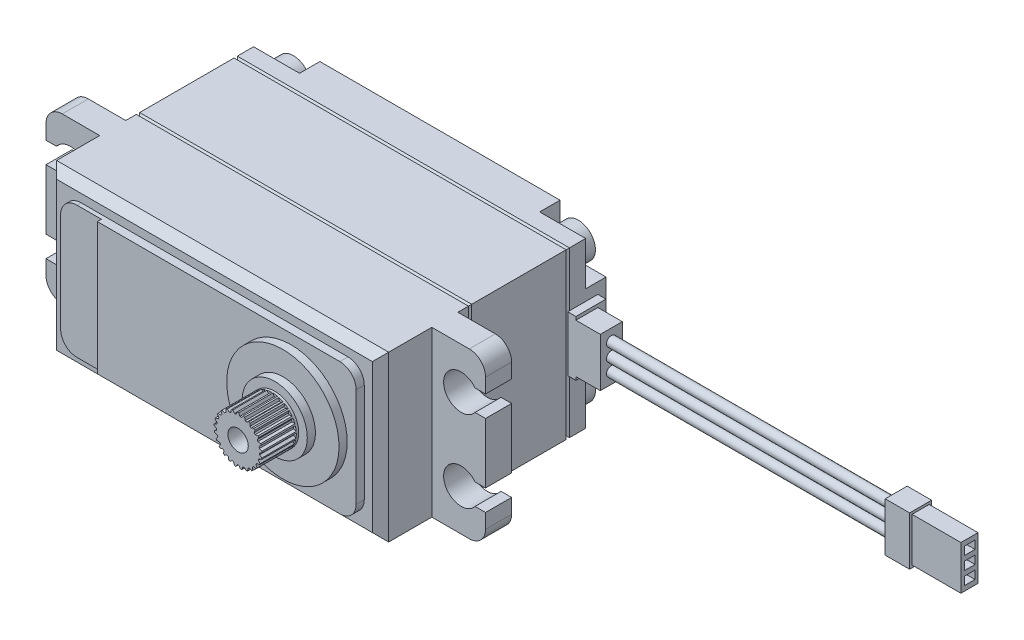
from build123d import *

# Parameters (mm, degrees)
SKETCH_1_W          = 40.8
SKETCH_1_H          = 20.2
EXTRUDE_1_DEPTH     = 4.7
CHAMFER_1_SIZE      = 0.2
SKETCH_2_W          = 40.8
SKETCH_2_H          = 20.2
EXTRUDE_2_DEPTH     = 12
CHAMFER_5_SIZE      = 0.2
SKETCH_3_W          = 40.8
SKETCH_3_H          = 20.2
EXTRUDE_3_DEPTH     = 11
CHAMFER_6_SIZE      = 0.2
CHAMFER_3_SIZE      = 1
CHAMFER_4_SIZE      = 0.2
SKETCH_4_R          = 6.9
EXTRUDE_4_DEPTH     = 2
SKETCH_5_R          = 4
EXTRUDE_5_DEPTH     = 1
SKETCH_6_R          = 2.95
EXTRUDE_6_DEPTH     = 4.5
SKETCH_7_R          = 1.25
CUT_EXTRUDE_1_DEPTH = 5
CUT_EXTRUDE_2_DEPTH = 4.2
EXTRUDE_7_DEPTH     = 3.2
FILLET_1_R          = 2
SKETCH_10_W         = 36.8
SKETCH_10_H         = 16.2
SKETCH_10_R         = 6.9
EXTRUDE_8_DEPTH     = 1
SKETCH_11_W         = 5
SKETCH_11_H         = 16.2
CUT_EXTRUDE_3_DEPTH = 0.5
FILLET_2_R          = 2
SKETCH_12_W         = 3.7
SKETCH_12_H         = 6.8
EXTRUDE_9_DEPTH     = 1
SKETCH_13_W         = 2.7
SKETCH_13_H         = 6
EXTRUDE_10_DEPTH    = 3
SKETCH_14_R         = 0.6
EXTRUDE_11_DEPTH    = 35
SKETCH_15_W         = 2.7
SKETCH_15_H         = 6
EXTRUDE_12_DEPTH    = 3
SKETCH_16_W         = 2.1
SKETCH_16_H         = 5.4
SKETCH_16_W_2       = 1.300246416
SKETCH_16_H_2       = 1
EXTRUDE_13_DEPTH    = 6
SKETCH_17_R         = 1
CUT_EXTRUDE_4_DEPTH = 2.5
SKETCH_18_R         = 1
CUT_EXTRUDE_5_DEPTH = 2.5
SKETCH_19_R         = 2.1
EXTRUDE_14_DEPTH    = 2


with BuildPart() as part:
    # 草图1 → 凸台-拉伸1 (new body)
    with BuildSketch(Plane.XY):
        Rectangle(SKETCH_1_W, SKETCH_1_H)
    extrude(amount=EXTRUDE_1_DEPTH)

    # 倒角1
    chamfer_1_edges = [part.edges().sort_by_distance(p)[0] for p in [
        (0, -10.1, 4.7),
        (20.4, 0, 4.7),
        (-20.4, 0, 4.7),
        (0, 10.1, 4.7),
    ]]
    chamfer(chamfer_1_edges, length=CHAMFER_1_SIZE)



with BuildPart() as body_2:
    # 草图2 → 凸台-拉伸2 (new body)
    with BuildSketch(Plane.XY.offset(4.7)):
        Rectangle(SKETCH_2_W, SKETCH_2_H)
    extrude(amount=EXTRUDE_2_DEPTH)

    # 倒角5
    chamfer_5_edges = [body_2.edges().sort_by_distance(p)[0] for p in [
        (0, -10.1, 16.7),
        (20.4, 0, 16.7),
        (-20.4, 0, 16.7),
        (0, 10.1, 16.7),
    ]]
    chamfer(chamfer_5_edges, length=CHAMFER_5_SIZE)

    # 倒角4
    chamfer_4_edges = [body_2.edges().sort_by_distance(p)[0] for p in [
        (0, 10.1, 4.7),
        (20.4, 0, 4.7),
        (0, -10.1, 4.7),
        (-20.4, 0, 4.7),
    ]]
    chamfer(chamfer_4_edges, length=CHAMFER_4_SIZE)


with BuildPart() as body_3:
    # 草图3 → 凸台-拉伸3 (new body)
    with BuildSketch(Plane.XY.offset(16.7)):
        Rectangle(SKETCH_3_W, SKETCH_3_H)
    extrude(amount=EXTRUDE_3_DEPTH)

    # 倒角6
    chamfer_6_edges = [body_3.edges().sort_by_distance(p)[0] for p in [
        (0, 10.1, 16.7),
        (20.4, 0, 16.7),
        (-20.4, 0, 16.7),
        (0, -10.1, 16.7),
    ]]
    chamfer(chamfer_6_edges, length=CHAMFER_6_SIZE)

    # 倒角3
    chamfer_3_edges = [body_3.edges().sort_by_distance(p)[0] for p in [
        (20.4, 0, 27.7),
        (0, -10.1, 27.7),
        (-20.4, 0, 27.7),
        (0, 10.1, 27.7),
    ]]
    chamfer(chamfer_3_edges, length=CHAMFER_3_SIZE)

    # 草图4 → 凸台-拉伸4 (add)
    with BuildSketch(Plane.XY.offset(27.7)):
        with Locations((10.4, 0)):
            Circle(SKETCH_4_R)
    extrude(amount=EXTRUDE_4_DEPTH)

    # 草图5 → 凸台-拉伸5 (add)
    with BuildSketch(Plane.XY.offset(29.7)):
        with Locations((10.4, 0)):
            Circle(SKETCH_5_R)
    extrude(amount=EXTRUDE_5_DEPTH)

    # 草图6 → 凸台-拉伸6 (add)
    with BuildSketch(Plane.XY.offset(30.7)):
        with Locations((10.4, 0)):
            Circle(SKETCH_6_R)
    extrude(amount=EXTRUDE_6_DEPTH)

    # 草图7 → 切除-拉伸1 (cut)
    with BuildSketch(Plane.XY.offset(35.2)):
        with Locations((10.4, 0)):
            Circle(SKETCH_7_R)
    extrude(amount=-CUT_EXTRUDE_1_DEPTH, mode=Mode.SUBTRACT)

    # 草图8 → 切除-拉伸2 (cut)
    with BuildSketch(Plane.XY.offset(35.2)):
        with BuildLine():
            Line((11.036355222, 2.880547176), (10.812882687, 2.613339954))
            ThreePointArc((10.812882687, 2.613339954), (10.718629565, 2.62690868), (10.623963172, 2.637206039))
            Line((10.623963172, 2.637206039), (10.475180758, 2.949041853))
            ThreePointArc((10.475180758, 2.949041853), (10.757412567, 2.928268474), (11.036355222, 2.880547176))
        make_face()
        with BuildLine():
            Line((10.3, 2.948304598), (10.15, 2.633916823))
            ThreePointArc((10.15, 2.633916823), (10.055333608, 2.623619464), (9.961080485, 2.610050738))
            Line((9.961080485, 2.610050738), (9.739421931, 2.875088975))
            ThreePointArc((9.739421931, 2.875088975), (10.017953037, 2.925156426), (10.3, 2.948304598))
        make_face()
        with BuildLine():
            Line((11.732725904, 2.631794381), (11.449822437, 2.428557325))
            ThreePointArc((11.449822437, 2.428557325), (11.361904854, 2.465139563), (11.27277343, 2.498655986))
            Line((11.27277343, 2.498655986), (11.206215702, 2.837695587))
            ThreePointArc((11.206215702, 2.837695587), (11.47441455, 2.747386645), (11.732725904, 2.631794381))
        make_face()
        with BuildLine():
            Line((12.345356517, 2.217676266), (12.020797982, 2.091179508))
            ThreePointArc((12.020797982, 2.091179508), (11.944740124, 2.148476661), (11.866744123, 2.203106188))
            Line((11.866744123, 2.203106188), (11.886593149, 2.54804647))
            ThreePointArc((11.886593149, 2.54804647), (12.123907116, 2.393876408), (12.345356517, 2.217676266))
        make_face()
        with BuildLine():
            Line((12.835753225, 1.664213396), (12.489932828, 1.622405191))
            ThreePointArc((12.489932828, 1.622405191), (12.430513691, 1.696817069), (12.368553888, 1.769127125))
            Line((12.368553888, 1.769127125), (12.47356248, 2.098294222))
            ThreePointArc((12.47356248, 2.098294222), (12.665080258, 1.889950112), (12.835753225, 1.664213396))
        make_face()
        with BuildLine():
            Line((13.1731026, 1.006181877), (12.827749509, 1.051689189))
            ThreePointArc((12.827749509, 1.051689189), (12.788702615, 1.13854022), (12.746672173, 1.223987299))
            Line((12.746672173, 1.223987299), (12.930242255, 1.516698431))
            ThreePointArc((12.930242255, 1.516698431), (13.063930076, 1.2672713), (13.1731026, 1.006181877))
        make_face()
        with BuildLine():
            Line((13.33620774, 0.28492825), (13.01302176, 0.414891688))
            ThreePointArc((13.01302176, 0.414891688), (12.996800569, 0.508724701), (12.977340415, 0.601939849))
            Line((12.977340415, 0.601939849), (13.227937603, 0.8398029))
            ThreePointArc((13.227937603, 0.8398029), (13.295395371, 0.564965172), (13.33620774, 0.28492825))
        make_face()
        with BuildLine():
            Line((13.314820149, -0.454228466), (13.034108243, -0.247974984))
            ThreePointArc((13.034108243, -0.247974984), (13.041731992, -0.153055861), (13.04606488, -0.057929695))
            Line((13.04606488, -0.057929695), (13.347943232, 0.110139464))
            ThreePointArc((13.347943232, 0.110139464), (13.344932326, -0.172839796), (13.314820149, -0.454228466))
        make_face()
        with BuildLine():
            Line((13.110283688, -1.164844338), (12.889684018, -0.895260476))
            ThreePointArc((12.889684018, -0.895260476), (12.920673679, -0.805219361), (12.948527356, -0.714159303))
            Line((12.948527356, -0.714159303), (13.282718745, -0.626444439))
            ThreePointArc((13.282718745, -0.626444439), (13.209428352, -0.899784604), (13.110283688, -1.164844338))
        make_face()
        with BuildLine():
            Line((12.735450135, -1.802268755), (12.58882379, -1.486293459))
            ThreePointArc((12.58882379, -1.486293459), (12.641232168, -1.406787967), (12.690856486, -1.325515656))
            Line((12.690856486, -1.325515656), (13.036362438, -1.323666535))
            ThreePointArc((13.036362438, -1.323666535), (12.897397663, -1.570192636), (12.735450135, -1.802268755))
        make_face()
        with BuildLine():
            Line((12.213871661, -2.326449999), (12.150431713, -1.983937159))
            ThreePointArc((12.150431713, -1.983937159), (12.220965797, -1.919962911), (12.289242678, -1.853584986))
            Line((12.289242678, -1.853584986), (12.624353783, -1.937717794))
            ThreePointArc((12.624353783, -1.937717794), (12.428446294, -2.14193969), (12.213871661, -2.326449999))
        make_face()
        with BuildLine():
            Line((11.57832096, -2.704451833), (11.602053574, -2.35692279))
            ThreePointArc((11.602053574, -2.35692279), (11.686281449, -2.312499524), (11.768920805, -2.265186753))
            Line((11.768920805, -2.265186753), (12.072580799, -2.430015117))
            ThreePointArc((12.072580799, -2.430015117), (11.832040183, -2.579100795), (11.57832096, -2.704451833))
        make_face()
        with BuildLine():
            Line((10.868732019, -2.912523012), (10.978145988, -2.581814294))
            ThreePointArc((10.978145988, -2.581814294), (11.070775306, -2.559733288), (11.162584602, -2.534458507))
            Line((11.162584602, -2.534458507), (11.415713412, -2.769625654))
            ThreePointArc((11.415713412, -2.769625654), (11.145653722, -2.854207513), (10.868732019, -2.912523012))
        make_face()
        with BuildLine():
            Line((10.129690921, -2.937589659), (10.317911363, -2.644480911))
            ThreePointArc((10.317911363, -2.644480911), (10.413121884, -2.646129595), (10.508332405, -2.644480911))
            Line((10.508332405, -2.644480911), (10.695025016, -2.935210425))
            ThreePointArc((10.695025016, -2.935210425), (10.412415095, -2.949973875), (10.129690921, -2.937589659))
        make_face()
        with BuildLine():
            Line((9.407634337, -2.778076743), (9.662834669, -2.540985066))
            ThreePointArc((9.662834669, -2.540985066), (9.754643965, -2.566259847), (9.847273284, -2.588340853))
            Line((9.847273284, -2.588340853), (9.955799113, -2.91636513))
            ThreePointArc((9.955799113, -2.91636513), (9.678396382, -2.86038253), (9.407634337, -2.778076743))
        make_face()
        with BuildLine():
            Line((8.747931738, -2.444007049), (9.054076784, -2.277829785))
            ThreePointArc((9.054076784, -2.277829785), (9.13671614, -2.325142556), (9.220944015, -2.369565821))
            Line((9.220944015, -2.369565821), (9.244483986, -2.714273888))
            ThreePointArc((9.244483986, -2.714273888), (8.989718678, -2.59106283), (8.747931738, -2.444007049))
        make_face()
        with BuildLine():
            Line((8.192034663, -1.956371404), (8.529888205, -1.871550081))
            ThreePointArc((8.529888205, -1.871550081), (8.598165086, -1.937928006), (8.66869917, -2.001902254))
            Line((8.66869917, -2.001902254), (8.605774179, -2.341634836))
            ThreePointArc((8.605774179, -2.341634836), (8.389654136, -2.158937124), (8.192034663, -1.956371404))
        make_face()
        with BuildLine():
            Line((7.77487217, -1.345809748), (8.123205627, -1.347674002))
            ThreePointArc((8.123205627, -1.347674002), (8.172829946, -1.428946313), (8.225238324, -1.508451805))
            Line((8.225238324, -1.508451805), (8.07980218, -1.821862254))
            ThreePointArc((8.07980218, -1.821862254), (7.915907018, -1.591157458), (7.77487217, -1.345809748))
        make_face()
        with BuildLine():
            Line((7.522656114, -0.650685916), (7.859582414, -0.73911861))
            ThreePointArc((7.859582414, -0.73911861), (7.887436091, -0.830178667), (7.918425752, -0.920219782))
            Line((7.918425752, -0.920219782), (7.699616742, -1.187615367))
            ThreePointArc((7.699616742, -1.187615367), (7.598244598, -0.923399517), (7.522656114, -0.650685916))
        make_face()
        with BuildLine():
            Line((7.451234156, 0.085322905), (7.75558298, -0.084121676))
            ThreePointArc((7.75558298, -0.084121676), (7.759915868, -0.179247843), (7.767539616, -0.274166966))
            Line((7.767539616, -0.274166966), (7.489106316, -0.478746239))
            ThreePointArc((7.489106316, -0.478746239), (7.456626774, -0.197620989), (7.451234156, 0.085322905))
        make_face()
        with BuildLine():
            Line((7.565094001, 0.815970574), (7.817741993, 0.576160931))
            ThreePointArc((7.817741993, 0.576160931), (7.79828184, 0.482945783), (7.782060648, 0.38911277))
            Line((7.782060648, 0.38911277), (7.461498046, 0.260204276))
            ThreePointArc((7.461498046, 0.260204276), (7.499951915, 0.540574793), (7.565094001, 0.815970574))
        make_face()
        with BuildLine():
            Line((7.857081416, 1.495347811), (8.042153774, 1.200241228))
            ThreePointArc((8.042153774, 1.200241228), (8.000123332, 1.114794149), (7.961076438, 1.027943118))
            Line((7.961076438, 1.027943118), (7.61852666, 0.9828052))
            ThreePointArc((7.61852666, 0.9828052), (7.725497743, 1.244804273), (7.857081416, 1.495347811))
        make_face()
        with BuildLine():
            Line((8.308849758, 2.080766845), (8.414717705, 1.748905955))
            ThreePointArc((8.414717705, 1.748905955), (8.352757902, 1.676595898), (8.293338765, 1.602184021))
            Line((8.293338765, 1.602184021), (7.950325474, 1.643652858))
            ThreePointArc((7.950325474, 1.643652858), (8.119092384, 1.870818122), (8.308849758, 2.080766845))
        make_face()
        with BuildLine():
            Line((8.89201276, 2.535443646), (8.912024223, 2.187680488))
            ThreePointArc((8.912024223, 2.187680488), (8.834028222, 2.133050962), (8.757970364, 2.075753808))
            Line((8.757970364, 2.075753808), (8.436046348, 2.201223763))
            ThreePointArc((8.436046348, 2.201223763), (8.656004839, 2.379281589), (8.89201276, 2.535443646))
        make_face()
        with BuildLine():
            Line((9.569928146, 2.830809198), (9.502825732, 2.488995011))
            ThreePointArc((9.502825732, 2.488995011), (9.413694308, 2.455478588), (9.325776725, 2.41889635))
            Line((9.325776725, 2.41889635), (9.045169653, 2.620483682))
            ThreePointArc((9.045169653, 2.620483682), (9.302498923, 2.738246042), (9.569928146, 2.830809198))
        make_face()
    extrude(amount=-CUT_EXTRUDE_2_DEPTH, mode=Mode.SUBTRACT)

    # 草图9 → 凸台-拉伸7 (add)
    with BuildSketch(Plane.XY.offset(18.2)):
        with BuildLine():
            Line((20.4, -10.1), (27, -10.1))
            Line((27, -10.1), (27, -6.3))
            Line((27, -6.3), (25.712454379, -6.3))
            ThreePointArc((25.712454379, -6.3), (21.85, -5), (25.712454379, -3.7))
            Line((25.712454379, -3.7), (27, -3.7))
            Line((27, -3.7), (27, 3.7))
            Line((27, 3.7), (25.712454379, 3.7))
            ThreePointArc((25.712454379, 3.7), (21.85, 5), (25.712454379, 6.3))
            Line((25.712454379, 6.3), (27, 6.3))
            Line((27, 6.3), (27, 10.1))
            Line((27, 10.1), (20.4, 10.1))
            Line((20.4, 10.1), (20.4, -10.1))
        make_face()
        with BuildLine():
            Line((-27, 10.1), (-27, 6.3))
            Line((-27, 6.3), (-25.712454379, 6.3))
            ThreePointArc((-25.712454379, 6.3), (-21.85, 5), (-25.712454379, 3.7))
            Line((-25.712454379, 3.7), (-27, 3.7))
            Line((-27, 3.7), (-27, -3.7))
            Line((-27, -3.7), (-25.712454379, -3.7))
            ThreePointArc((-25.712454379, -3.7), (-21.85, -5), (-25.712454379, -6.3))
            Line((-25.712454379, -6.3), (-27, -6.3))
            Line((-27, -6.3), (-27, -10.1))
            Line((-27, -10.1), (-20.4, -10.1))
            Line((-20.4, -10.1), (-20.4, 10.1))
            Line((-20.4, 10.1), (-27, 10.1))
        make_face()
    extrude(amount=EXTRUDE_7_DEPTH)

    # 圆角1
    fillet_1_edges = [body_3.edges().sort_by_distance(p)[0] for p in [
        (27, 10.1, 19.8),
        (27, -10.1, 19.8),
        (-27, -10.1, 19.8),
        (-27, 10.1, 19.8),
    ]]
    fillet(fillet_1_edges, radius=FILLET_1_R)

    # 草图10 → 凸台-拉伸8 (add)
    with BuildSketch(Plane.XY.offset(27.7)):
        Rectangle(SKETCH_10_W, SKETCH_10_H)
        with Locations((10.4, 0)):
            Circle(SKETCH_10_R, mode=Mode.SUBTRACT)
    extrude(amount=EXTRUDE_8_DEPTH)

    # 草图11 → 切除-拉伸3 (cut)
    with BuildSketch(Plane.XY.offset(28.7)):
        with Locations((-15.9, 0)):
            Rectangle(SKETCH_11_W, SKETCH_11_H)
    extrude(amount=-CUT_EXTRUDE_3_DEPTH, mode=Mode.SUBTRACT)

    # 圆角2
    fillet_2_edges = [body_3.edges().sort_by_distance(p)[0] for p in [
        (-18.4, 8.1, 27.95),
        (18.4, 8.1, 28.2),
        (18.4, -8.1, 28.2),
        (-18.4, -8.1, 27.95),
    ]]
    fillet(fillet_2_edges, radius=FILLET_2_R)


with BuildPart() as part_1:
    add(part.part)

    add(body_2.part)  # 凸台-拉伸9 merges body 2
    # 草图12 → 凸台-拉伸9 (add)
    with BuildSketch(Plane(origin=(20.4, 0, 0), x_dir=(0, 0, -1), z_dir=(1, 0, 0))):
        with Locations((-2.85, 0)):
            Rectangle(SKETCH_12_W, SKETCH_12_H)
    extrude(amount=EXTRUDE_9_DEPTH)

    # 草图13 → 凸台-拉伸10 (add)
    with BuildSketch(Plane(origin=(21.4, 0, 0), x_dir=(0, 0, -1), z_dir=(1, 0, 0))):
        with Locations((-3.35, 0)):
            Rectangle(SKETCH_13_W, SKETCH_13_H)
    extrude(amount=EXTRUDE_10_DEPTH)

    # 草图14 → 凸台-拉伸11 (add)
    with BuildSketch(Plane(origin=(24.4, 0, 0), x_dir=(0, 0, -1), z_dir=(1, 0, 0))):
        with Locations((-3.35, 1.6)):
            Circle(SKETCH_14_R)
        with Locations((-3.35, 0)):
            Circle(SKETCH_14_R)
        with Locations((-3.35, -1.6)):
            Circle(SKETCH_14_R)
    extrude(amount=EXTRUDE_11_DEPTH)

    # 草图15 → 凸台-拉伸12 (add)
    with BuildSketch(Plane(origin=(59.4, 0, 0), x_dir=(0, 0, -1), z_dir=(1, 0, 0))):
        with Locations((-3.35, 0)):
            Rectangle(SKETCH_15_W, SKETCH_15_H)
    extrude(amount=EXTRUDE_12_DEPTH)

    # 草图16 → 凸台-拉伸13 (add)
    with BuildSketch(Plane(origin=(62.4, 0, 0), x_dir=(0, 0, -1), z_dir=(1, 0, 0))):
        with Locations((-3.35, 0)):
            Rectangle(SKETCH_16_W, SKETCH_16_H)
        with Locations((-3.316419984, 1.6)):
            Rectangle(SKETCH_16_W_2, SKETCH_16_H_2, mode=Mode.SUBTRACT)
        with Locations((-3.316419984, 0)):
            Rectangle(SKETCH_16_W_2, SKETCH_16_H_2, mode=Mode.SUBTRACT)
        with Locations((-3.316419984, -1.6)):
            Rectangle(SKETCH_16_W_2, SKETCH_16_H_2, mode=Mode.SUBTRACT)
    extrude(amount=EXTRUDE_13_DEPTH)

    # 草图17 → 切除-拉伸4 (cut)
    # profile 1 of 4: a face of its own
    with BuildSketch(Plane(origin=(0, 0, 0), x_dir=(-1, 0, 0), z_dir=(0, 0, -1))):
        with BuildLine():
            Line((-14.75, 7.5), (-14.75, 10.1))
            Line((-14.75, 10.1), (-20.4, 10.1))
            Line((-20.4, 10.1), (-20.4, 4.75))
            Line((-20.4, 4.75), (-17.5, 4.75))
            ThreePointArc((-17.5, 4.75), (-15.555456352, 5.555456352), (-14.75, 7.5))
        make_face()
        with Locations((-17.5, 7.5)):
            Circle(SKETCH_17_R, mode=Mode.SUBTRACT)
    # profile 2 of 4: a face of its own
    with BuildSketch(Plane(origin=(0, 0, 0), x_dir=(-1, 0, 0), z_dir=(0, 0, -1))):
        with BuildLine():
            Line((-17.5, -4.75), (-20.4, -4.75))
            Line((-20.4, -4.75), (-20.4, -10.1))
            Line((-20.4, -10.1), (-14.75, -10.1))
            Line((-14.75, -10.1), (-14.75, -7.5))
            ThreePointArc((-14.75, -7.5), (-15.555456352, -5.555456352), (-17.5, -4.75))
        make_face()
        with Locations((-17.5, -7.5)):
            Circle(SKETCH_17_R, mode=Mode.SUBTRACT)
    # profile 3 of 4: a face of its own
    with BuildSketch(Plane(origin=(0, 0, 0), x_dir=(-1, 0, 0), z_dir=(0, 0, -1))):
        with BuildLine():
            Line((17.5, -4.75), (20.4, -4.75))
            Line((20.4, -4.75), (20.4, -10.1))
            Line((20.4, -10.1), (14.75, -10.1))
            Line((14.75, -10.1), (14.75, -7.5))
            ThreePointArc((14.75, -7.5), (15.555456352, -5.555456352), (17.5, -4.75))
        make_face()
        with Locations((17.5, -7.5)):
            Circle(SKETCH_17_R, mode=Mode.SUBTRACT)
    # profile 4 of 4: a face of its own
    with BuildSketch(Plane(origin=(0, 0, 0), x_dir=(-1, 0, 0), z_dir=(0, 0, -1))):
        with BuildLine():
            Line((14.75, 7.5), (14.75, 10.1))
            Line((14.75, 10.1), (20.4, 10.1))
            Line((20.4, 10.1), (20.4, 4.75))
            Line((20.4, 4.75), (17.5, 4.75))
            ThreePointArc((17.5, 4.75), (15.555456352, 5.555456352), (14.75, 7.5))
        make_face()
        with Locations((17.5, 7.5)):
            Circle(SKETCH_17_R, mode=Mode.SUBTRACT)
    extrude(amount=-CUT_EXTRUDE_4_DEPTH, mode=Mode.SUBTRACT)

    # 草图18 → 切除-拉伸5 (cut)
    with BuildSketch(Plane(origin=(0, 0, 0), x_dir=(-1, 0, 0), z_dir=(0, 0, -1))):
        with Locations((-17.5, -7.5)):
            Circle(SKETCH_18_R)
        with Locations((-17.5, 7.5)):
            Circle(SKETCH_18_R)
        with Locations((17.5, 7.5)):
            Circle(SKETCH_18_R)
        with Locations((17.5, -7.5)):
            Circle(SKETCH_18_R)
    extrude(amount=-CUT_EXTRUDE_5_DEPTH, mode=Mode.SUBTRACT)

    # 草图19 → 凸台-拉伸14 (add)
    # profile 1 of 4: a face of its own
    with BuildSketch(Plane(origin=(0, 0, 2.5), x_dir=(-1, 0, 0), z_dir=(0, 0, -1))):
        with Locations((-17.5, 7.5)):
            Circle(SKETCH_19_R)
        with BuildLine():
            Line((-18, 7), (-18, 5.822949017))
            ThreePointArc((-18, 5.822949017), (-17.5, 5.75), (-17, 5.822949017))
            Line((-17, 5.822949017), (-17, 7))
            Line((-17, 7), (-15.822949017, 7))
            ThreePointArc((-15.822949017, 7), (-15.75, 7.5), (-15.822949017, 8))
            Line((-15.822949017, 8), (-17, 8))
            Line((-17, 8), (-17, 9.177050983))
            ThreePointArc((-17, 9.177050983), (-17.5, 9.25), (-18, 9.177050983))
            Line((-18, 9.177050983), (-18, 8))
            Line((-18, 8), (-19.177050983, 8))
            ThreePointArc((-19.177050983, 8), (-19.25, 7.5), (-19.177050983, 7))
            Line((-19.177050983, 7), (-18, 7))
        make_face(mode=Mode.SUBTRACT)
    # profile 2 of 4: a face of its own
    with BuildSketch(Plane(origin=(0, 0, 2.5), x_dir=(-1, 0, 0), z_dir=(0, 0, -1))):
        with Locations((-17.5, -7.5)):
            Circle(SKETCH_19_R)
        with BuildLine():
            Line((-17, -7), (-15.822949017, -7))
            ThreePointArc((-15.822949017, -7), (-15.75, -7.5), (-15.822949017, -8))
            Line((-15.822949017, -8), (-17, -8))
            Line((-17, -8), (-17, -9.177050983))
            ThreePointArc((-17, -9.177050983), (-17.5, -9.25), (-18, -9.177050983))
            Line((-18, -9.177050983), (-18, -8))
            Line((-18, -8), (-19.177050983, -8))
            ThreePointArc((-19.177050983, -8), (-19.25, -7.5), (-19.177050983, -7))
            Line((-19.177050983, -7), (-18, -7))
            Line((-18, -7), (-18, -5.822949017))
            ThreePointArc((-18, -5.822949017), (-17.5, -5.75), (-17, -5.822949017))
            Line((-17, -5.822949017), (-17, -7))
        make_face(mode=Mode.SUBTRACT)
    # profile 3 of 4: a face of its own
    with BuildSketch(Plane(origin=(0, 0, 2.5), x_dir=(-1, 0, 0), z_dir=(0, 0, -1))):
        with Locations((17.5, 7.5)):
            Circle(SKETCH_19_R)
        with BuildLine():
            Line((17, 8), (15.822949017, 8))
            ThreePointArc((15.822949017, 8), (15.75, 7.5), (15.822949017, 7))
            Line((15.822949017, 7), (17, 7))
            Line((17, 7), (17, 5.822949017))
            ThreePointArc((17, 5.822949017), (17.5, 5.75), (18, 5.822949017))
            Line((18, 5.822949017), (18, 7))
            Line((18, 7), (19.177050983, 7))
            ThreePointArc((19.177050983, 7), (19.25, 7.5), (19.177050983, 8))
            Line((19.177050983, 8), (18, 8))
            Line((18, 8), (18, 9.177050983))
            ThreePointArc((18, 9.177050983), (17.5, 9.25), (17, 9.177050983))
            Line((17, 9.177050983), (17, 8))
        make_face(mode=Mode.SUBTRACT)
    # profile 4 of 4: a face of its own
    with BuildSketch(Plane(origin=(0, 0, 2.5), x_dir=(-1, 0, 0), z_dir=(0, 0, -1))):
        with Locations((17.5, -7.5)):
            Circle(SKETCH_19_R)
        with BuildLine():
            Line((17, -8), (15.822949017, -8))
            ThreePointArc((15.822949017, -8), (15.75, -7.5), (15.822949017, -7))
            Line((15.822949017, -7), (17, -7))
            Line((17, -7), (17, -5.822949017))
            ThreePointArc((17, -5.822949017), (17.5, -5.75), (18, -5.822949017))
            Line((18, -5.822949017), (18, -7))
            Line((18, -7), (19.177050983, -7))
            ThreePointArc((19.177050983, -7), (19.25, -7.5), (19.177050983, -8))
            Line((19.177050983, -8), (18, -8))
            Line((18, -8), (18, -9.177050983))
            ThreePointArc((18, -9.177050983), (17.5, -9.25), (17, -9.177050983))
            Line((17, -9.177050983), (17, -8))
        make_face(mode=Mode.SUBTRACT)
    extrude(amount=EXTRUDE_14_DEPTH)


solid = Compound([body_3.part, part_1.part])
